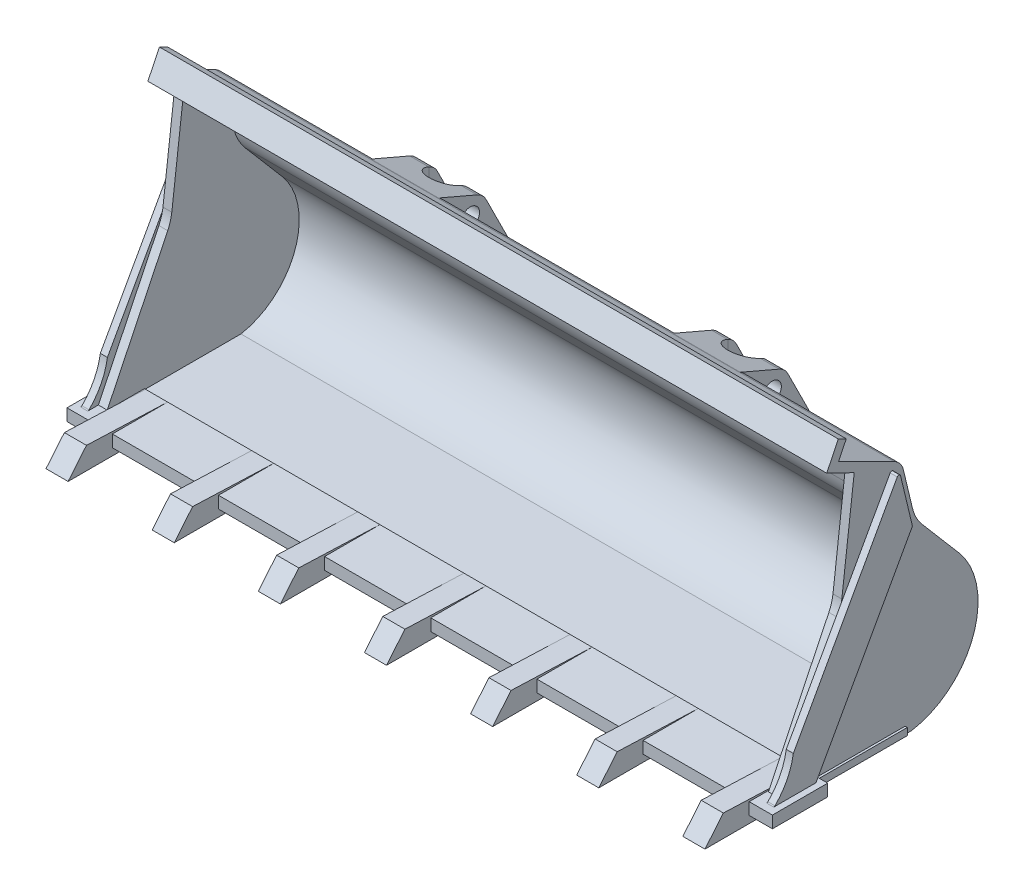
from build123d import *

# Parameters (mm, degrees)
BOSS_EXTRUDE1_DEPTH     = 38.375
FILLET1_R               = 5
FILLET2_R               = 2
FILLET3_R               = 5
SHELL1_DEPTH            = 37.375
SKETCH2_W               = 6.25
SKETCH2_H               = 1.35
BOSS_EXTRUDE2_DEPTH     = 39.875
SKETCH3_W               = 10.25
SKETCH3_H               = 0.8
BOSS_EXTRUDE3_DEPTH     = 38.625
BOSS_EXTRUDE4_DEPTH     = 0.8
FILLET4_R               = 0.2
FILLET5_R               = 0.2
BOSS_EXTRUDE5_DEPTH     = 20.875
CUT_EXTRUDE6_OUTLINE_W  = 26.5
CUT_EXTRUDE6_OUTLINE_H  = 18
CUT_EXTRUDE6_DEPTH      = 27.270174138
SKETCH12_W              = 26.5
SKETCH12_H              = 4.973459815
CUT_EXTRUDE7_DEPTH      = 0.125
CUT_EXTRUDE8_DEPTH      = 0.125
CUT_EXTRUDE9_DEPTH      = 75.695590583
CUT_EXTRUDE9_DEPTH_BACK = 75.695590583
SKETCH15_R              = 1.05
BOSS_EXTRUDE6_DEPTH     = 1.25
LPATTERN1_COUNT         = 4
LPATTERN1_PITCH         = 12
MIRROR2_COPY_1_DEPTH    = 1.25
MIRROR2_COPY_2_DEPTH    = 1.25
MIRROR2_COPY_3_DEPTH    = 1.25
MIRROR2_COPY_4_DEPTH    = 1.25


# Read off the part's stored shape, not the designer's step: Shell1, Cut-Extrude6
with BuildPart() as part:
    # Sketch1 → Boss-Extrude1 (new body)
    with BuildSketch(Plane(origin=(0, 0, 0), x_dir=(0, 0, -1), z_dir=(1, 0, 0))):
        with BuildLine():
            Line((0, 0), (15.25, 0))
            ThreePointArc((15.25, 0), (22.209961359, 5.79934068), (20.59945846, 14.714479201))
            Line((20.59945846, 14.714479201), (15.610384424, 20.564479201))
            Line((15.610384424, 20.564479201), (14.090730941, 26.914479201))
            Line((14.090730941, 26.914479201), (6.979313726, 30.466512171))
            Line((6.979313726, 30.466512171), (7.849651047, 32.267210077))
            Line((7.849651047, 32.267210077), (6.949302094, 32.702378737))
            Line((6.949302094, 32.702378737), (5.643796113, 30.001331879))
            Line((5.643796113, 30.001331879), (8.75, 28.5))
            Line((8.75, 28.5), (7.25, 16))
            Line((7.25, 16), (0, 1))
            Line((0, 1), (0, 0))
        make_face()
    extrude(amount=BOSS_EXTRUDE1_DEPTH)

    # Fillet1
    fillet1_edges = [part.edges().sort_by_distance(p)[0] for p in [
        (19.1875, 20.564479201, -15.610384424),
    ]]
    fillet(fillet1_edges, radius=FILLET1_R)

    # Fillet2
    fillet2_edges = [part.edges().sort_by_distance(p)[0] for p in [
        (19.1875, 26.914479201, -14.090730941),
    ]]
    fillet(fillet2_edges, radius=FILLET2_R)

    # Fillet3
    fillet3_edges = [part.edges().sort_by_distance(p)[0] for p in [
        (19.1875, 16, -7.25),
    ]]
    fillet(fillet3_edges, radius=FILLET3_R)

    # Shell1 outline → Shell1 (cut)
    with BuildSketch(Plane.YZ):
        with BuildLine():
            Line((1, 0), (1, -15.163683739))
            ThreePointArc((1, -15.163683739), (6.17928908, -21.283947402), (14.065580168, -19.838583933))
            Line((14.065580168, -19.838583933), (19.002231107, -15.628444271))
            ThreePointArc((19.002231107, -15.628444271), (20.175541683, -14.845687588), (21.499164512, -14.358462448))
            Line((21.499164512, -14.358462448), (25.774731748, -13.335252899))
            ThreePointArc((25.774731748, -13.335252899), (26.163937886, -13.145772007), (26.436600355, -12.809558378))
            Line((26.436600355, -12.809558378), (28.466301144, -8.745956137))
            Line((28.466301144, -8.745956137), (16.828671243, -7.349440549))
            ThreePointArc((16.828671243, -7.349440549), (16.019438965, -7.183607383), (15.248554043, -6.886801121))
            Line((15.248554043, -6.886801121), (1, 0))
        make_face()
    extrude(amount=SHELL1_DEPTH, mode=Mode.SUBTRACT)

    # Sketch2 → Boss-Extrude2 (add)
    with BuildSketch(Plane(origin=(0, 0, 0), x_dir=(0, 0, -1), z_dir=(1, 0, 0))):
        with Locations((1.125, 0.425)):
            Rectangle(SKETCH2_W, SKETCH2_H)
    extrude(amount=BOSS_EXTRUDE2_DEPTH)

    # Sketch3 → Boss-Extrude3 (add)
    with BuildSketch(Plane(origin=(0, 0, 0), x_dir=(0, 0, -1), z_dir=(1, 0, 0))):
        with Locations((9.375, 0.4)):
            Rectangle(SKETCH3_W, SKETCH3_H)
    extrude(amount=BOSS_EXTRUDE3_DEPTH)

    # Sketch4 → Boss-Extrude4 (add)
    with BuildSketch(Plane(origin=(38.375, 0, 0), x_dir=(0, 0, -1), z_dir=(1, 0, 0))):
        with BuildLine():
            Line((-1.4, 0.8), (3.459254788, 0.8))
            Line((3.459254788, 0.8), (14.531709509, 20.775237084))
            Line((14.531709509, 20.775237084), (13.066413334, 26.898100502))
            Line((13.066413334, 26.898100502), (1.066675279, 5.25))
            ThreePointArc((1.066675279, 5.25), (0.233575409, 2.803144582), (-1.4, 0.8))
        make_face()
    extrude(amount=BOSS_EXTRUDE4_DEPTH)

    # Fillet4
    fillet4_edges = [part.edges().sort_by_distance(p)[0] for p in [
        (38.775, 20.775237084, -14.531709509),
        (38.775, 26.898100502, -13.066413334),
    ]]
    fillet(fillet4_edges, radius=FILLET4_R)

    # Fillet5
    fillet5_edges = [part.edges().sort_by_distance(p)[0] for p in [
        (38.775, 1.1, 1.070915731),
    ]]
    fillet(fillet5_edges, radius=FILLET5_R)

    # Mirror1: part across plane


with BuildPart() as part_1:
    add(part.part)
    add(part.part.mirror(Plane(origin=(0, 0, 0), x_dir=(0, 0, 1), z_dir=(1, 0, 0))))


with BuildPart() as body_2:
    # Sketch9 → Boss-Extrude5 (new, symmetric)
    with BuildSketch(Plane(origin=(0, 0, 0), x_dir=(0, 0, -1), z_dir=(1, 0, 0))):
        with BuildLine():
            Line((4.25, 0), (14.5, 0))
            Line((14.5, 0), (15.25, 0))
            ThreePointArc((15.25, 0), (22.209961359, 5.79934068), (20.59945846, 14.714479201))
            Line((20.59945846, 14.714479201), (16.389318797, 19.65113014))
            ThreePointArc((16.389318797, 19.65113014), (15.737021561, 20.628888953), (15.331000612, 21.731907978))
            Line((15.331000612, 21.731907978), (14.307791062, 26.007475214))
            ThreePointArc((14.307791062, 26.007475214), (13.96795484, 26.73496951), (13.369379352, 27.270174138))
            Line((13.369379352, 27.270174138), (17.749838629, 25.387425237))
            ThreePointArc((17.749838629, 25.387425237), (18.333312354, 25.004001261), (18.749439084, 24.443381891))
            Line((18.749439084, 24.443381891), (24.76347107, 12.398441024))
            ThreePointArc((24.76347107, 12.398441024), (24.891185186, 12.121881235), (25.001820705, 11.838057356))
            Line((25.001820705, 11.838057356), (28.53909014, 1.876953035))
            ThreePointArc((28.53909014, 1.876953035), (28.350911315, 0.509820699), (27.125568597, -0.125))
            Line((27.125568597, -0.125), (4.25, -0.125))
            Line((4.25, -0.125), (4.25, 0))
        make_face()
    extrude(amount=BOSS_EXTRUDE5_DEPTH, both=True)

    # Cut-Extrude6 outline → Cut-Extrude6 (cut)
    with BuildSketch(Plane(origin=(0, 0, 0), x_dir=(1, 0, 0), z_dir=(0, 1, 0))):
        with BuildLine():
            ThreePointArc((-18.75, 17.791737009), (-16.9, 15.941737009), (-15.05, 17.791737009))
            Line((-15.05, 17.791737009), (-15.05, 30))
            Line((-15.05, 30), (-18.75, 30))
            Line((-18.75, 30), (-18.75, 17.791737009))
        make_face()
        with Locations((0, 21)):
            Rectangle(CUT_EXTRUDE6_OUTLINE_W, CUT_EXTRUDE6_OUTLINE_H)
        with BuildLine():
            Line((18.75, 30), (15.05, 30))
            Line((15.05, 30), (15.05, 17.791737009))
            ThreePointArc((15.05, 17.791737009), (16.9, 15.941737009), (18.75, 17.791737009))
            Line((18.75, 17.791737009), (18.75, 30))
        make_face()
    extrude(amount=CUT_EXTRUDE6_DEPTH, mode=Mode.SUBTRACT)

    # Sketch12 → Cut-Extrude7 (cut)
    with BuildSketch(Plane(origin=(0, 0, 0), x_dir=(1, 0, 0), z_dir=(0, 1, 0))):
        with Locations((0, 25.23831763)):
            Rectangle(SKETCH12_W, SKETCH12_H)
    extrude(amount=-CUT_EXTRUDE7_DEPTH, mode=Mode.SUBTRACT)

    # Sketch14 → Cut-Extrude8 (cut)
    with BuildSketch(Plane(origin=(0, 0, 0), x_dir=(1, 0, 0), z_dir=(0, 1, 0))):
        Polygon((13.25, 15.969407112), (13.25, 22.751587723), (-13.25, 22.751587723), (-13.25, 16.610056767), align=None)
    extrude(amount=-CUT_EXTRUDE8_DEPTH, mode=Mode.SUBTRACT)

    # Sketch15 → Cut-Extrude9 (cut, two sides: drawn at the far end of the back side and taken through both)
    with BuildSketch(Plane(origin=(20.875, 0, 0), x_dir=(0, 0, -1), z_dir=(1, 0, 0)).offset(-CUT_EXTRUDE9_DEPTH_BACK)):
        with Locations((16.960083548, 23.54995771)):
            Circle(SKETCH15_R)
        with Locations((27.125568597, 1.375)):
            Circle(SKETCH15_R)
    extrude(amount=CUT_EXTRUDE9_DEPTH + CUT_EXTRUDE9_DEPTH_BACK, mode=Mode.SUBTRACT)

    # Combine1: union part
    add(part_1.part)

    # Sketch17 → Boss-Extrude6 (add, symmetric)
    with BuildSketch(Plane(origin=(0, 0, 0), x_dir=(0, 0, -1), z_dir=(1, 0, 0))):
        Polygon((4.25, 1.1), (3.75, -0.25), (3.75, -1.05), (-7, -1.05), (-4.923344034, 1.45), align=None)
    boss_extrude6 = extrude(amount=BOSS_EXTRUDE6_DEPTH, both=True)

    # LPattern1: Boss-Extrude6 ×4
    with Locations(*[(-i * LPATTERN1_PITCH, 0, 0) for i in range(1, LPATTERN1_COUNT)]):
        add(boss_extrude6)

    # Mirror2 copy 1 sketch → Mirror2 copy 1 (add, symmetric)
    with BuildSketch(Plane(origin=(12, 0, 0), x_dir=(0, 0, -1), z_dir=(-1, 0, 0))):
        Polygon((4.25, -1.1), (3.75, 0.25), (3.75, 1.05), (-7, 1.05), (-4.923344034, -1.45), align=None)
    extrude(amount=MIRROR2_COPY_1_DEPTH, both=True)

    # Mirror2 copy 2 sketch → Mirror2 copy 2 (add, symmetric)
    with BuildSketch(Plane(origin=(24, 0, 0), x_dir=(0, 0, -1), z_dir=(-1, 0, 0))):
        Polygon((4.25, -1.1), (3.75, 0.25), (3.75, 1.05), (-7, 1.05), (-4.923344034, -1.45), align=None)
    extrude(amount=MIRROR2_COPY_2_DEPTH, both=True)

    # Mirror2 copy 3 sketch → Mirror2 copy 3 (add, symmetric)
    with BuildSketch(Plane(origin=(36, 0, 0), x_dir=(0, 0, -1), z_dir=(-1, 0, 0))):
        Polygon((4.25, -1.1), (3.75, 0.25), (3.75, 1.05), (-7, 1.05), (-4.923344034, -1.45), align=None)
    extrude(amount=MIRROR2_COPY_3_DEPTH, both=True)

    # Mirror2 copy 4 sketch → Mirror2 copy 4 (add, symmetric)
    with BuildSketch(Plane(origin=(0, 0, 0), x_dir=(0, 0, -1), z_dir=(-1, 0, 0))):
        Polygon((4.25, -1.1), (3.75, 0.25), (3.75, 1.05), (-7, 1.05), (-4.923344034, -1.45), align=None)
    extrude(amount=MIRROR2_COPY_4_DEPTH, both=True)


solid = body_2.part
